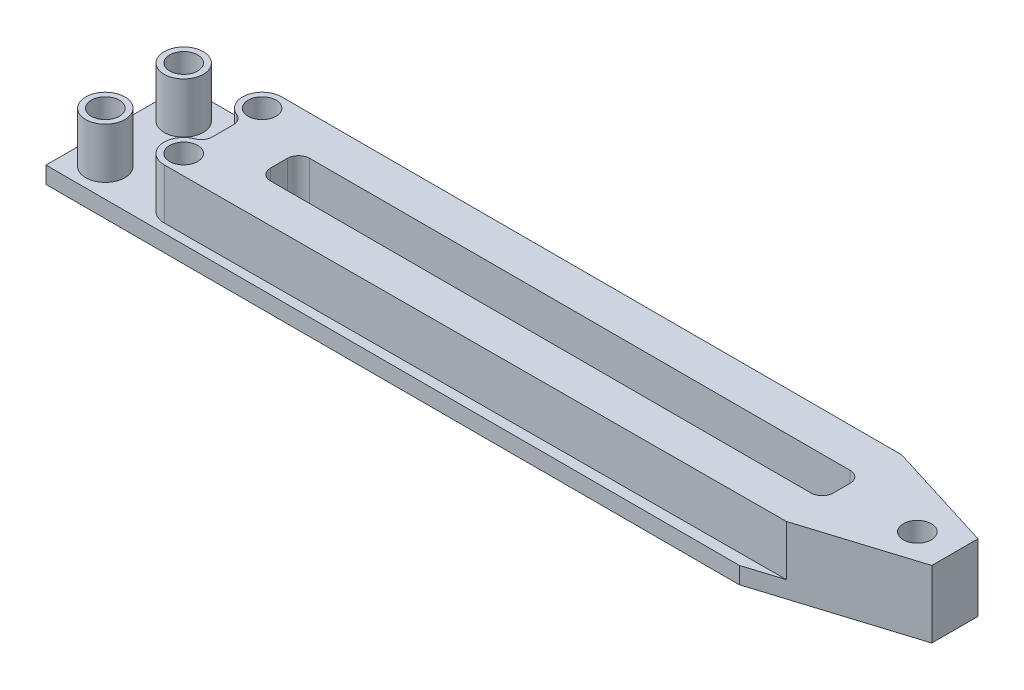
from build123d import *

# Parameters (mm, degrees)
SKETCH_2_W          = 123.80594
SKETCH_2_H          = 24.590071156
EXTRUDE_2_DEPTH     = 3
SKETCH_3_R          = 3.5
SKETCH_3_R_2        = 2.5
EXTRUDE_3_DEPTH     = 9
EXTRUDE_4_DEPTH     = 9
SKETCH_7_W          = 100.499997397
SKETCH_7_H          = 7
CUT_EXTRUDE_1_DEPTH = 9
SKETCH_8_R          = 2.5
CUT_EXTRUDE_2_DEPTH = 153.544398733
FILLET_1_R          = 2
CUT_EXTRUDE_START   = -9
SKETCH_9_R          = 2.5
CUT_EXTRUDE_3_DEPTH = 9


# Read off the part's stored shape, not the designer's step: 凸台-拉伸4
with BuildPart() as part:
    # 草图2 → 凸台-拉伸2 (new body)
    with BuildSketch(Plane(origin=(0, 0, 0), x_dir=(1, 0, 0), z_dir=(0, 1, 0))):
        with Locations((61.90297, 12.720846688)):
            Rectangle(SKETCH_2_W, SKETCH_2_H)
        Polygon((149.999997397, 8.59581111), (123.80594, 0.42581111), (123.80594, 25.015882266), (149.999997397, 16.845882266), align=None)
    extrude(amount=EXTRUDE_2_DEPTH)

    # 草图3 → 凸台-拉伸3 (add)
    # profile 1 of 4: a face of its own
    with BuildSketch(Plane(origin=(0, 3, 0), x_dir=(1, 0, 0), z_dir=(0, 1, 0))):
        with Locations(Location((5.5, 19.515882266, 0), (0, 0, 270))):
            Circle(SKETCH_3_R)
        with Locations(Location((5.5, 19.515882266, 0), (0, 0, 270))):
            Circle(SKETCH_3_R_2, mode=Mode.SUBTRACT)
    # profile 2 of 4: a face of its own
    with BuildSketch(Plane(origin=(0, 3, 0), x_dir=(1, 0, 0), z_dir=(0, 1, 0))):
        with Locations(Location((19.5, 19.515882266, 0), (0, 0, 270))):
            Circle(SKETCH_3_R)
        with Locations(Location((19.5, 19.515882266, 0), (0, 0, 270))):
            Circle(SKETCH_3_R_2, mode=Mode.SUBTRACT)
    # profile 3 of 4: a face of its own
    with BuildSketch(Plane(origin=(0, 3, 0), x_dir=(1, 0, 0), z_dir=(0, 1, 0))):
        with Locations(Location((19.5, 5.515882266, 0), (0, 0, 270))):
            Circle(SKETCH_3_R)
        with Locations(Location((19.5, 5.515882266, 0), (0, 0, 270))):
            Circle(SKETCH_3_R_2, mode=Mode.SUBTRACT)
    # profile 4 of 4: a face of its own
    with BuildSketch(Plane(origin=(0, 3, 0), x_dir=(1, 0, 0), z_dir=(0, 1, 0))):
        with Locations(Location((5.5, 5.515882266, 0), (0, 0, 270))):
            Circle(SKETCH_3_R)
        with Locations(Location((5.5, 5.515882266, 0), (0, 0, 270))):
            Circle(SKETCH_3_R_2, mode=Mode.SUBTRACT)
    extrude(amount=EXTRUDE_3_DEPTH)

    # 凸台-拉伸4 outline → 凸台-拉伸4 (add)
    with BuildSketch(Plane(origin=(0, 3, 0), x_dir=(1, 0, 0), z_dir=(0, 1, 0))):
        with BuildLine():
            Line((19.525916812, 2.015978222), (130.218193953, 2.42581111))
            Line((130.218193953, 2.42581111), (149.999997397, 8.59581111))
            Line((149.999997397, 8.59581111), (149.999997397, 16.845882266))
            Line((149.999997397, 16.845882266), (130.218193953, 23.015882266))
            Line((130.218193953, 23.015882266), (19.5, 23.015882266))
            ThreePointArc((19.5, 23.015882266), (23, 19.515882266), (19.5, 16.015882266))
            Line((19.5, 16.015882266), (19.5, 9.015882266))
            ThreePointArc((19.5, 9.015882266), (22.999976011, 5.528840761), (19.525916812, 2.015978222))
        make_face()
    extrude(amount=EXTRUDE_4_DEPTH)

    # 草图7 → 切除-拉伸1 (cut)
    with BuildSketch(Plane(origin=(0, 12, 0), x_dir=(1, 0, 0), z_dir=(0, 1, 0))):
        with Locations((79.749998699, 12.515882266)):
            Rectangle(SKETCH_7_W, SKETCH_7_H)
    extrude(amount=-CUT_EXTRUDE_1_DEPTH, mode=Mode.SUBTRACT)

    # 草图8 → 切除-拉伸2 (cut, through all)
    with BuildSketch(Plane.XZ):
        with Locations(Location((143.499997397, -12.515882266, 0), (0, 0, 270))):
            Circle(SKETCH_8_R)
    extrude(amount=-CUT_EXTRUDE_2_DEPTH, mode=Mode.SUBTRACT)

    # 圆角1
    fillet_1_edges = [part.edges().sort_by_distance(p)[0] for p in [
        (19.5, 7.5, -16.015882266),
        (19.5, 7.5, -9.015882266),
        (29.5, 7.5, -9.015882266),
        (29.5, 7.5, -16.015882266),
        (129.999997397, 7.5, -16.015882266),
        (129.999997397, 7.5, -9.015882266),
    ]]
    fillet(fillet_1_edges, radius=FILLET_1_R)

    # 草图9 → 切除-拉伸3 (cut)
    with BuildSketch(Plane(origin=(0, 3, 0), x_dir=(1, 0, 0), z_dir=(0, 1, 0)).offset(CUT_EXTRUDE_START)):
        with Locations(Location((5.5, 5.515882266, 0), (0, 0, 270))):
            Circle(SKETCH_9_R)
        with Locations(Location((19.5, 5.515882266, 0), (0, 0, 270))):
            Circle(SKETCH_9_R)
        with Locations(Location((19.5, 19.515882266, 0), (0, 0, 270))):
            Circle(SKETCH_9_R)
        with Locations(Location((5.5, 19.515882266, 0), (0, 0, 270))):
            Circle(SKETCH_9_R)
    extrude(amount=CUT_EXTRUDE_3_DEPTH, mode=Mode.SUBTRACT)


solid = part.part
